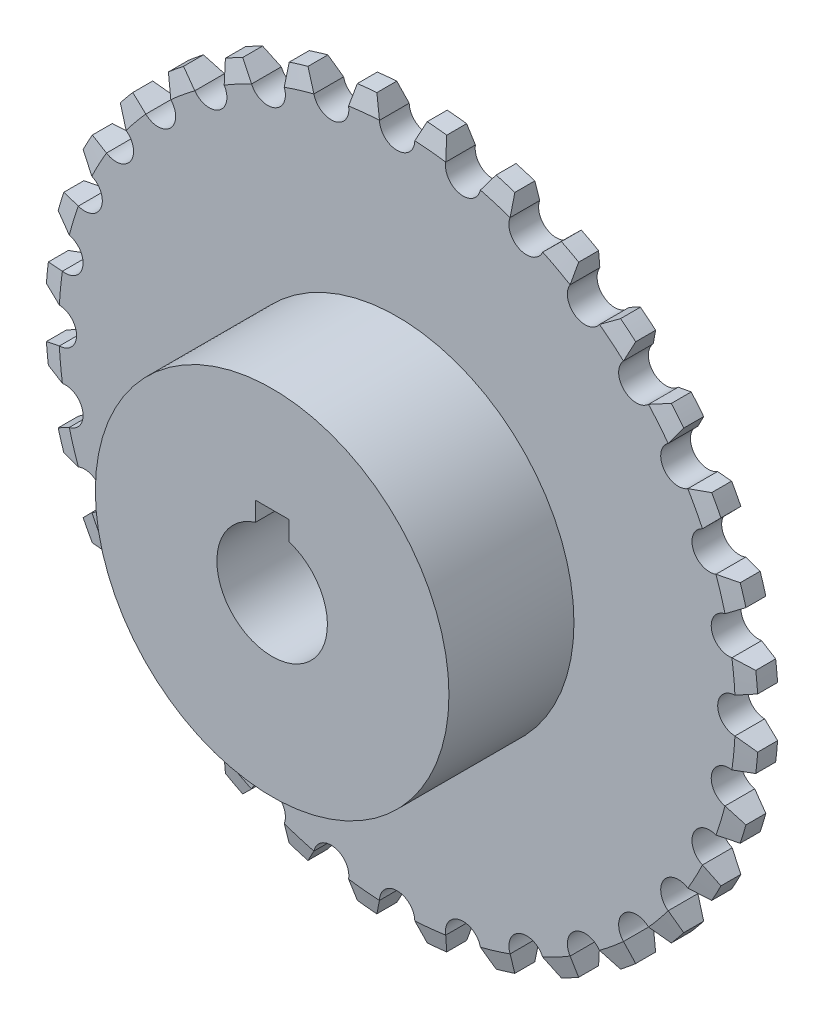
from build123d import *

# Parameters (mm, degrees)
SKETCH3_R             = 2.54
ROLLERCUT_DEPTH       = 76.758056872
CIRPATTERN1_START     = -2.1336
CIRPATTERN1_OUTLINE_R = 2.54
CIRPATTERN1_DEPTH     = 4.2672
CUT_EXTRUDE1_DEPTH    = 76.758057007
CIRPATTERN2_START     = -2.133600101
CIRPATTERN2_DEPTH     = 4.267200201
SKETCH8_W             = 4.7752
SKETCH8_H             = 4.7752
KEYSLOT_DEPTH         = 76.585207065


# Read off the part's stored shape, not the designer's step: CirPattern1, CirPattern2
with BuildPart() as part:
    # Sketch2 → Base-Main (revolve)
    with BuildSketch(Plane(origin=(0, 0, 0), x_dir=(0, 0, -1), z_dir=(1, 0, 0)), mode=Mode.PRIVATE) as base_main_sk:
        Polygon((2.1336, 7.9375), (-20.0914, 7.9375), (-20.0914, 25.4), (-2.1336, 25.4), (-2.1336, 48.588440593), (-1.43062635, 51.211973971), (1.43062635, 51.211973971), (2.1336, 48.588440593), align=None)
    revolve(base_main_sk.sketch.rotate(Axis((0, 0, -67.468329941), (0, 0, 1)), 90), axis=Axis((0, 0, -67.468329941), (0, 0, 1)))

    # Sketch3 → RollerCut (cut, through all)
    with BuildSketch(Plane(origin=(0, 0, -2.1336), x_dir=(-1, 0, 0), z_dir=(0, 0, -1))):
        with Locations(Location((0, 48.588440593, 0), (0, 0, 358.50223782))):
            Circle(SKETCH3_R)
    extrude(amount=-ROLLERCUT_DEPTH, mode=Mode.SUBTRACT)

    # CirPattern1 outline → CirPattern1 (cut)
    with BuildSketch(Plane.XY.offset(CIRPATTERN1_START)):
        with Locations((-9.479134522, 47.654827331)):
            Circle(CIRPATTERN1_OUTLINE_R)
        with Locations((-18.593991219, 44.889865781)):
            Circle(CIRPATTERN1_OUTLINE_R)
        with Locations((-26.994291262, 40.399811862)):
            Circle(CIRPATTERN1_OUTLINE_R)
        with Locations((-34.357215831, 34.357215831)):
            Circle(CIRPATTERN1_OUTLINE_R)
        with Locations((-40.399811862, 26.994291262)):
            Circle(CIRPATTERN1_OUTLINE_R)
        with Locations((-44.889865781, 18.593991219)):
            Circle(CIRPATTERN1_OUTLINE_R)
        with Locations((-47.654827331, 9.479134522)):
            Circle(CIRPATTERN1_OUTLINE_R)
        with Locations((-48.588440593, 0)):
            Circle(CIRPATTERN1_OUTLINE_R)
        with Locations((-47.654827331, -9.479134522)):
            Circle(CIRPATTERN1_OUTLINE_R)
        with Locations((-44.889865781, -18.593991219)):
            Circle(CIRPATTERN1_OUTLINE_R)
        with Locations((-40.399811862, -26.994291262)):
            Circle(CIRPATTERN1_OUTLINE_R)
        with Locations((-34.357215831, -34.357215831)):
            Circle(CIRPATTERN1_OUTLINE_R)
        with Locations((-26.994291262, -40.399811862)):
            Circle(CIRPATTERN1_OUTLINE_R)
        with Locations((-18.593991219, -44.889865781)):
            Circle(CIRPATTERN1_OUTLINE_R)
        with Locations((-9.479134522, -47.654827331)):
            Circle(CIRPATTERN1_OUTLINE_R)
        with Locations((0, -48.588440593)):
            Circle(CIRPATTERN1_OUTLINE_R)
        with Locations((9.479134522, -47.654827331)):
            Circle(CIRPATTERN1_OUTLINE_R)
        with Locations((18.593991219, -44.889865781)):
            Circle(CIRPATTERN1_OUTLINE_R)
        with Locations((26.994291262, -40.399811862)):
            Circle(CIRPATTERN1_OUTLINE_R)
        with Locations((34.357215831, -34.357215831)):
            Circle(CIRPATTERN1_OUTLINE_R)
        with Locations((40.399811862, -26.994291262)):
            Circle(CIRPATTERN1_OUTLINE_R)
        with Locations((44.889865781, -18.593991219)):
            Circle(CIRPATTERN1_OUTLINE_R)
        with Locations((47.654827331, -9.479134522)):
            Circle(CIRPATTERN1_OUTLINE_R)
        with Locations((48.588440593, 0)):
            Circle(CIRPATTERN1_OUTLINE_R)
        with Locations((47.654827331, 9.479134522)):
            Circle(CIRPATTERN1_OUTLINE_R)
        with Locations((44.889865781, 18.593991219)):
            Circle(CIRPATTERN1_OUTLINE_R)
        with Locations((40.399811862, 26.994291262)):
            Circle(CIRPATTERN1_OUTLINE_R)
        with Locations((34.357215831, 34.357215831)):
            Circle(CIRPATTERN1_OUTLINE_R)
        with Locations((26.994291262, 40.399811862)):
            Circle(CIRPATTERN1_OUTLINE_R)
        with Locations((18.593991219, 44.889865781)):
            Circle(CIRPATTERN1_OUTLINE_R)
        with Locations((9.479134522, 47.654827331)):
            Circle(CIRPATTERN1_OUTLINE_R)
    extrude(amount=CIRPATTERN1_DEPTH, mode=Mode.SUBTRACT)

    # Sketch4 → Cut-Extrude1 (cut, through all)
    with BuildSketch(Plane(origin=(0, 0, -2.1336), x_dir=(-1, 0, 0), z_dir=(0, 0, -1))):
        Polygon((2.5391322, 48.522050317), (3.616604365, 51.084111531), (0.538736082, 52.378505819), (-0.538736082, 49.816444605), align=None)
        Polygon((6.975838934, 48.085072844), (6.418903442, 50.808109162), (9.690155147, 51.477169712), (10.247090639, 48.754133394), align=None)
    extrude(amount=-CUT_EXTRUDE1_DEPTH, mode=Mode.SUBTRACT)

    # CirPattern2 outline → CirPattern2 (cut)
    with BuildSketch(Plane.XY.offset(CIRPATTERN2_START)):
        with BuildLine():
            ThreePointArc((-9.943738312, 50.237320255), (-11.735957067, 49.849108214), (-13.513128095, 49.396980142))
            Line((-13.513128095, 49.396980142), (-11.956525909, 47.094352607))
            ThreePointArc((-11.956525909, 47.094352607), (-11.605781191, 49.043702396), (-9.961898945, 50.148527095))
            Line((-9.961898945, 50.148527095), (-9.943738312, 50.237320255))
        make_face()
        with BuildLine():
            Line((2.539132201, 48.522050317), (3.616604365, 51.08411153))
            ThreePointArc((3.616604365, 51.08411153), (1.785375369, 51.180843221), (-0.048142817, 51.211951342))
            Line((-0.048142817, 51.211951342), (-0.01300845, 51.128407282))
            ThreePointArc((-0.01300845, 51.128407282), (1.814827666, 50.365516996), (2.539132201, 48.522050317))
        make_face()
        with BuildLine():
            Line((11.956525909, 47.094352607), (13.513128095, 49.396980141))
            ThreePointArc((13.513128095, 49.396980141), (9.990960493, 50.227950251), (6.418903442, 50.808109162))
            Line((6.418903442, 50.808109162), (6.975838934, 48.085072844))
            ThreePointArc((6.975838934, 48.085072844), (9.97466394, 50.146021943), (11.956525909, 47.094352607))
        make_face()
        with BuildLine():
            Line((20.91443703, 43.856845337), (22.890349889, 45.811550507))
            ThreePointArc((22.890349889, 45.811550507), (19.597973977, 47.313694571), (16.20773639, 48.579579651))
            Line((16.20773639, 48.579579651), (16.22273249, 45.800212989))
            ThreePointArc((16.22273249, 45.800212989), (19.566007137, 47.236519794), (20.91443703, 43.856845337))
        make_face()
        with BuildLine():
            Line((29.068618067, 38.933944097), (31.387908375, 40.465608678))
            ThreePointArc((31.387908375, 40.465608678), (28.451848312, 42.581200142), (25.373715117, 44.484164138))
            Line((25.373715117, 44.484164138), (24.846195535, 41.755276633))
            ThreePointArc((24.846195535, 41.755276633), (28.405439654, 42.511744677), (29.068618067, 38.933944097))
        make_face()
        with BuildLine():
            Line((36.105708413, 32.514833219), (38.679247145, 33.564596202))
            ThreePointArc((38.679247145, 33.564596202), (36.212334072, 36.212334072), (33.564596202, 38.679247145))
            Line((33.564596202, 38.679247145), (32.514833219, 36.105708413))
            ThreePointArc((32.514833219, 36.105708413), (36.153267055, 36.153267055), (36.105708413, 32.514833219))
        make_face()
        with BuildLine():
            Line((41.755276633, 24.846195535), (44.484164137, 25.373715117))
            ThreePointArc((44.484164137, 25.373715117), (42.581200141, 28.451848312), (40.465608678, 31.387908375))
            Line((40.465608678, 31.387908375), (38.933944097, 29.068618067))
            ThreePointArc((38.933944097, 29.068618067), (42.511744677, 28.405439654), (41.755276633, 24.846195535))
        make_face()
        with BuildLine():
            Line((45.800212989, 16.22273249), (48.57957965, 16.207736389))
            ThreePointArc((48.57957965, 16.207736389), (47.31369457, 19.597973977), (45.811550506, 22.890349889))
            Line((45.811550506, 22.890349889), (43.856845337, 20.91443703))
            ThreePointArc((43.856845337, 20.91443703), (47.236519794, 19.566007137), (45.800212989, 16.22273249))
        make_face()
        with BuildLine():
            Line((48.085072844, 6.975838934), (50.80810916, 6.418903442))
            ThreePointArc((50.80810916, 6.418903442), (50.22795025, 9.990960493), (49.39698014, 13.513128094))
            Line((49.39698014, 13.513128094), (47.094352607, 11.956525909))
            ThreePointArc((47.094352607, 11.956525909), (50.146021943, 9.97466394), (48.085072844, 6.975838934))
        make_face()
        with BuildLine():
            Line((48.522050317, -2.5391322), (51.084111529, -3.616604365))
            ThreePointArc((51.084111529, -3.616604365), (51.211973969, 0), (51.084111529, 3.616604365))
            Line((51.084111529, 3.616604365), (48.522050317, 2.5391322))
            ThreePointArc((48.522050317, 2.5391322), (51.128440593, 0), (48.522050317, -2.5391322))
        make_face()
        with BuildLine():
            Line((47.094352607, -11.956525909), (49.39698014, -13.513128094))
            ThreePointArc((49.39698014, -13.513128094), (50.22795025, -9.990960493), (50.80810916, -6.418903442))
            Line((50.80810916, -6.418903442), (48.085072844, -6.975838934))
            ThreePointArc((48.085072844, -6.975838934), (50.146021943, -9.97466394), (47.094352607, -11.956525909))
        make_face()
        with BuildLine():
            Line((43.856845337, -20.91443703), (45.811550507, -22.890349889))
            ThreePointArc((45.811550507, -22.890349889), (47.31369457, -19.597973977), (48.57957965, -16.207736389))
            Line((48.57957965, -16.207736389), (45.800212989, -16.22273249))
            ThreePointArc((45.800212989, -16.22273249), (47.236519794, -19.566007137), (43.856845337, -20.91443703))
        make_face()
        with BuildLine():
            Line((38.933944097, -29.068618067), (40.465608678, -31.387908376))
            ThreePointArc((40.465608678, -31.387908376), (42.581200142, -28.451848312), (44.484164138, -25.373715117))
            Line((44.484164138, -25.373715117), (41.755276633, -24.846195535))
            ThreePointArc((41.755276633, -24.846195535), (42.511744677, -28.405439654), (38.933944097, -29.068618067))
        make_face()
        with BuildLine():
            Line((32.514833219, -36.105708413), (33.564596202, -38.679247145))
            ThreePointArc((33.564596202, -38.679247145), (36.212334072, -36.212334072), (38.679247145, -33.564596202))
            Line((38.679247145, -33.564596202), (36.105708413, -32.514833219))
            ThreePointArc((36.105708413, -32.514833219), (36.153267055, -36.153267055), (32.514833219, -36.105708413))
        make_face()
        with BuildLine():
            Line((24.846195535, -41.755276633), (25.373715118, -44.484164138))
            ThreePointArc((25.373715118, -44.484164138), (28.451848312, -42.581200142), (31.387908376, -40.465608679))
            Line((31.387908376, -40.465608679), (29.068618067, -38.933944097))
            ThreePointArc((29.068618067, -38.933944097), (28.405439654, -42.511744677), (24.846195535, -41.755276633))
        make_face()
        with BuildLine():
            Line((16.22273249, -45.800212989), (16.20773639, -48.579579651))
            ThreePointArc((16.20773639, -48.579579651), (19.597973977, -47.313694571), (22.89034989, -45.811550507))
            Line((22.89034989, -45.811550507), (20.91443703, -43.856845337))
            ThreePointArc((20.91443703, -43.856845337), (19.566007137, -47.236519794), (16.22273249, -45.800212989))
        make_face()
        with BuildLine():
            Line((6.975838934, -48.085072844), (6.418903442, -50.808109162))
            ThreePointArc((6.418903442, -50.808109162), (9.990960493, -50.227950251), (13.513128095, -49.396980141))
            Line((13.513128095, -49.396980141), (11.956525909, -47.094352607))
            ThreePointArc((11.956525909, -47.094352607), (9.97466394, -50.146021943), (6.975838934, -48.085072844))
        make_face()
        with BuildLine():
            Line((-2.5391322, -48.522050317), (-3.616604365, -51.084111531))
            ThreePointArc((-3.616604365, -51.084111531), (0, -51.211973971), (3.616604365, -51.084111531))
            Line((3.616604365, -51.084111531), (2.5391322, -48.522050317))
            ThreePointArc((2.5391322, -48.522050317), (0, -51.128440593), (-2.5391322, -48.522050317))
        make_face()
        with BuildLine():
            Line((-11.956525909, -47.094352607), (-13.513128095, -49.396980142))
            ThreePointArc((-13.513128095, -49.396980142), (-9.990960493, -50.227950252), (-6.418903442, -50.808109163))
            Line((-6.418903442, -50.808109163), (-6.975838934, -48.085072844))
            ThreePointArc((-6.975838934, -48.085072844), (-9.97466394, -50.146021943), (-11.956525909, -47.094352607))
        make_face()
        with BuildLine():
            Line((-20.91443703, -43.856845337), (-22.89034989, -45.811550509))
            ThreePointArc((-22.89034989, -45.811550509), (-19.597973978, -47.313694572), (-16.20773639, -48.579579653))
            Line((-16.20773639, -48.579579653), (-16.22273249, -45.800212989))
            ThreePointArc((-16.22273249, -45.800212989), (-19.566007137, -47.236519794), (-20.91443703, -43.856845337))
        make_face()
        with BuildLine():
            Line((-29.068618067, -38.933944097), (-31.387908377, -40.46560868))
            ThreePointArc((-31.387908377, -40.46560868), (-28.451848314, -42.581200144), (-25.373715118, -44.48416414))
            Line((-25.373715118, -44.48416414), (-24.846195535, -41.755276633))
            ThreePointArc((-24.846195535, -41.755276633), (-28.405439654, -42.511744677), (-29.068618067, -38.933944097))
        make_face()
        with BuildLine():
            Line((-36.105708413, -32.514833219), (-38.679247147, -33.564596204))
            ThreePointArc((-38.679247147, -33.564596204), (-36.212334074, -36.212334074), (-33.564596204, -38.679247147))
            Line((-33.564596204, -38.679247147), (-32.514833219, -36.105708413))
            ThreePointArc((-32.514833219, -36.105708413), (-36.153267055, -36.153267055), (-36.105708413, -32.514833219))
        make_face()
        with BuildLine():
            Line((-41.755276633, -24.846195535), (-44.48416414, -25.373715119))
            ThreePointArc((-44.48416414, -25.373715119), (-42.581200144, -28.451848314), (-40.465608681, -31.387908377))
            Line((-40.465608681, -31.387908377), (-38.933944097, -29.068618067))
            ThreePointArc((-38.933944097, -29.068618067), (-42.511744677, -28.405439654), (-41.755276633, -24.846195535))
        make_face()
        with BuildLine():
            Line((-45.800212989, -16.22273249), (-48.579579653, -16.20773639))
            ThreePointArc((-48.579579653, -16.20773639), (-47.313694573, -19.597973978), (-45.811550509, -22.890349891))
            Line((-45.811550509, -22.890349891), (-43.856845337, -20.91443703))
            ThreePointArc((-43.856845337, -20.91443703), (-47.236519794, -19.566007137), (-45.800212989, -16.22273249))
        make_face()
        with BuildLine():
            Line((-48.085072844, -6.975838934), (-50.808109164, -6.418903442))
            ThreePointArc((-50.808109164, -6.418903442), (-50.227950253, -9.990960493), (-49.396980143, -13.513128095))
            Line((-49.396980143, -13.513128095), (-47.094352607, -11.956525909))
            ThreePointArc((-47.094352607, -11.956525909), (-50.146021943, -9.97466394), (-48.085072844, -6.975838934))
        make_face()
        with BuildLine():
            Line((-48.522050317, 2.5391322), (-51.084111532, 3.616604365))
            ThreePointArc((-51.084111532, 3.616604365), (-51.211973973, 0), (-51.084111533, -3.616604365))
            Line((-51.084111533, -3.616604365), (-48.522050317, -2.5391322))
            ThreePointArc((-48.522050317, -2.5391322), (-51.128440593, 0), (-48.522050317, 2.5391322))
        make_face()
        with BuildLine():
            Line((-47.094352607, 11.956525909), (-49.396980143, 13.513128095))
            ThreePointArc((-49.396980143, 13.513128095), (-50.227950253, 9.990960493), (-50.808109164, 6.418903442))
            Line((-50.808109164, 6.418903442), (-48.085072844, 6.975838934))
            ThreePointArc((-48.085072844, 6.975838934), (-50.146021943, 9.97466394), (-47.094352607, 11.956525909))
        make_face()
        with BuildLine():
            Line((-43.856845337, 20.91443703), (-45.811550509, 22.890349891))
            ThreePointArc((-45.811550509, 22.890349891), (-47.313694573, 19.597973978), (-48.579579653, 16.20773639))
            Line((-48.579579653, 16.20773639), (-45.800212989, 16.22273249))
            ThreePointArc((-45.800212989, 16.22273249), (-47.236519794, 19.566007137), (-43.856845337, 20.91443703))
        make_face()
        with BuildLine():
            Line((-38.933944097, 29.068618067), (-40.46560868, 31.387908377))
            ThreePointArc((-40.46560868, 31.387908377), (-42.581200144, 28.451848314), (-44.48416414, 25.373715119))
            Line((-44.48416414, 25.373715119), (-41.755276633, 24.846195535))
            ThreePointArc((-41.755276633, 24.846195535), (-42.511744677, 28.405439654), (-38.933944097, 29.068618067))
        make_face()
        with BuildLine():
            Line((-32.514833219, 36.105708413), (-33.564596203, 38.679247146))
            ThreePointArc((-33.564596203, 38.679247146), (-36.212334074, 36.212334074), (-38.679247147, 33.564596204))
            Line((-38.679247147, 33.564596204), (-36.105708413, 32.514833219))
            ThreePointArc((-36.105708413, 32.514833219), (-36.153267055, 36.153267055), (-32.514833219, 36.105708413))
        make_face()
        with BuildLine():
            Line((-24.846195535, 41.755276633), (-25.373715118, 44.484164139))
            ThreePointArc((-25.373715118, 44.484164139), (-28.451848313, 42.581200143), (-31.387908377, 40.46560868))
            Line((-31.387908377, 40.46560868), (-29.068618067, 38.933944097))
            ThreePointArc((-29.068618067, 38.933944097), (-28.405439654, 42.511744677), (-24.846195535, 41.755276633))
        make_face()
        with BuildLine():
            Line((-16.22273249, 45.800212989), (-16.20773639, 48.579579652))
            ThreePointArc((-16.20773639, 48.579579652), (-19.597973978, 47.313694572), (-22.89034989, 45.811550508))
            Line((-22.89034989, 45.811550508), (-20.91443703, 43.856845337))
            ThreePointArc((-20.91443703, 43.856845337), (-19.566007137, 47.236519794), (-16.22273249, 45.800212989))
        make_face()
    extrude(amount=CIRPATTERN2_DEPTH, mode=Mode.SUBTRACT)

    # Sketch8 → KeySlot (cut, through all)
    with BuildSketch(Plane(origin=(0, 0, -2.1336), x_dir=(-1, 0, 0), z_dir=(0, 0, -1))):
        with Locations((0, 7.9375)):
            Rectangle(SKETCH8_W, SKETCH8_H)
    extrude(amount=-KEYSLOT_DEPTH, mode=Mode.SUBTRACT)


solid = part.part
